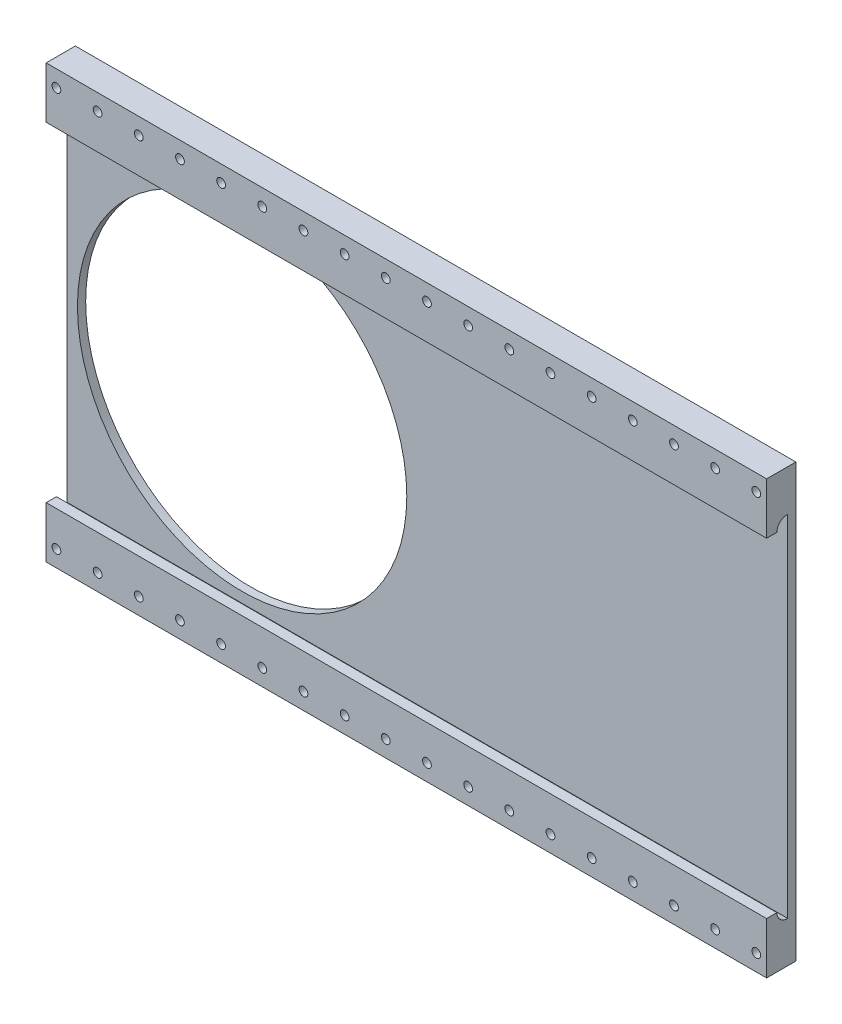
from build123d import *

# Parameters (mm, degrees)
SKETCH1_W             = 222.25
SKETCH1_H             = 114.3
SKETCH1_R             = 50.8
BOSS_EXTRUDE1_DEPTH   = 2.54
BOSS_EXTRUDE2_DEPTH   = 222.25
SKETCH4_W             = 222.25
SKETCH4_H             = 9.525
BOSS_EXTRUDE3_DEPTH   = 9.017
F_6_32_TAPPED_HOLE1_D = 2.7051
LPATTERN1_COUNT       = 18
LPATTERN1_PITCH       = 12.7
FILLET1_R             = 3.175


with BuildPart() as part:
    # Sketch1 → Boss-Extrude1 (new body)
    with BuildSketch(Plane.XY):
        with Locations((57.15, 0)):
            Rectangle(SKETCH1_W, SKETCH1_H)
        Circle(SKETCH1_R, mode=Mode.SUBTRACT)
    extrude(amount=BOSS_EXTRUDE1_DEPTH)

    # Sketch3 → Boss-Extrude2 (add)
    with BuildSketch(Plane(origin=(168.275, 0, 0), x_dir=(0, 0, -1), z_dir=(1, 0, 0))):
        Polygon((-2.54, 57.15), (-9.017, 57.15), (-9.017, 50.8), (-5.842, 50.8), (-5.842, 53.975), (-2.54, 53.975), align=None)
    boss_extrude2 = extrude(amount=-BOSS_EXTRUDE2_DEPTH)

    # Mirror1: Boss-Extrude2 across plane
    add(boss_extrude2.mirror(Plane(origin=(0, 0, 0), x_dir=(0, 0, 1), z_dir=(0, -1, 0))))

    # Sketch4 → Boss-Extrude3 (add)
    with BuildSketch(Plane.XY):
        with Locations((57.15, -61.9125)):
            Rectangle(SKETCH4_W, SKETCH4_H)
        with Locations((57.15, 61.9125)):
            Rectangle(SKETCH4_W, SKETCH4_H)
    extrude(amount=BOSS_EXTRUDE3_DEPTH)

    # #6-32 Tapped Hole1 (through all)
    with Locations(Plane.XY.offset(9.017)):
        with Locations((-50.8, -61.595), (-50.8, 61.595)):
            f_6_32_tapped_hole1 = Hole(F_6_32_TAPPED_HOLE1_D / 2)

    # LPattern1: #6-32 Tapped Hole1 ×18
    with Locations(*[(i * LPATTERN1_PITCH, 0, 0) for i in range(1, LPATTERN1_COUNT)]):
        add(f_6_32_tapped_hole1, mode=Mode.SUBTRACT)

    # Fillet1
    fillet1_edges = [part.edges().sort_by_distance(p)[0] for p in [
        (57.15, 53.975, 5.842),
        (57.15, -53.975, 5.842),
    ]]
    fillet(fillet1_edges, radius=FILLET1_R - 0.0001)  # a hair under: the kernel refuses the full size


solid = part.part
